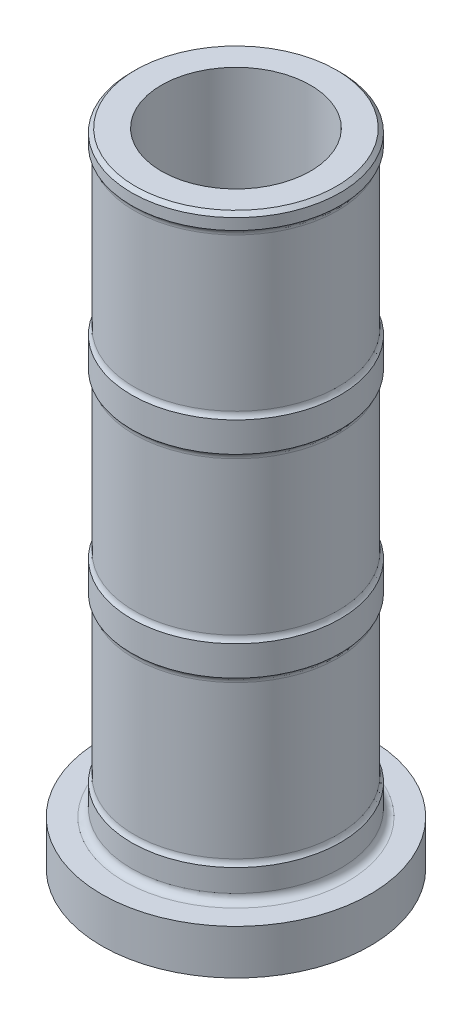
from build123d import *

# Parameters (mm, degrees)
SKETCH1_R           = 9
BOSS_EXTRUDE1_DEPTH = 3
SKETCH2_R           = 7
BOSS_EXTRUDE2_DEPTH = 2
SKETCH3_R           = 6.825
BOSS_EXTRUDE3_DEPTH = 11
SKETCH4_R           = 7
BOSS_EXTRUDE4_DEPTH = 2
SKETCH5_R           = 6.825
BOSS_EXTRUDE5_DEPTH = 11
SKETCH6_R           = 7
BOSS_EXTRUDE6_DEPTH = 2
SKETCH7_R           = 6.825
BOSS_EXTRUDE7_DEPTH = 11
SKETCH8_R           = 7
BOSS_EXTRUDE8_DEPTH = 1
FILLET3_R           = 0.5
CHAMFER2_SIZE       = 0.25
SKETCH13_R          = 5
CUT_EXTRUDE1_DEPTH  = 15
SKETCH14_R          = 4
CUT_EXTRUDE2_DEPTH  = 28
FILLET4_R           = 1


# Some blends are built 0.0001 mm under size
with BuildPart() as part:
    # Sketch1 → Boss-Extrude1 (new body)
    with BuildSketch(Plane(origin=(0, 0, 0), x_dir=(1, 0, 0), z_dir=(0, 1, 0))):
        with Locations(Location((0, 0, 0), (0, 0, 270))):
            Circle(SKETCH1_R)
    extrude(amount=BOSS_EXTRUDE1_DEPTH)

    # Sketch2 → Boss-Extrude2 (add)
    with BuildSketch(Plane(origin=(0, 3, 0), x_dir=(1, 0, 0), z_dir=(0, 1, 0))):
        with Locations(Location((0, 0, 0), (0, 0, 270))):
            Circle(SKETCH2_R)
    extrude(amount=BOSS_EXTRUDE2_DEPTH)

    # Sketch3 → Boss-Extrude3 (add)
    with BuildSketch(Plane(origin=(0, 5, 0), x_dir=(1, 0, 0), z_dir=(0, 1, 0))):
        with Locations(Location((0, 0, 0), (0, 0, 270))):
            Circle(SKETCH3_R)
    extrude(amount=BOSS_EXTRUDE3_DEPTH)

    # Sketch4 → Boss-Extrude4 (add)
    with BuildSketch(Plane(origin=(0, 16, 0), x_dir=(1, 0, 0), z_dir=(0, 1, 0))):
        with Locations(Location((0, 0, 0), (0, 0, 270))):
            Circle(SKETCH4_R)
    extrude(amount=BOSS_EXTRUDE4_DEPTH)

    # Sketch5 → Boss-Extrude5 (add)
    with BuildSketch(Plane(origin=(0, 18, 0), x_dir=(1, 0, 0), z_dir=(0, 1, 0))):
        with Locations(Location((0, 0, 0), (0, 0, 270))):
            Circle(SKETCH5_R)
    extrude(amount=BOSS_EXTRUDE5_DEPTH)

    # Sketch6 → Boss-Extrude6 (add)
    with BuildSketch(Plane(origin=(0, 29, 0), x_dir=(1, 0, 0), z_dir=(0, 1, 0))):
        with Locations(Location((0, 0, 0), (0, 0, 270))):
            Circle(SKETCH6_R)
    extrude(amount=BOSS_EXTRUDE6_DEPTH)

    # Sketch7 → Boss-Extrude7 (add)
    with BuildSketch(Plane(origin=(0, 31, 0), x_dir=(1, 0, 0), z_dir=(0, 1, 0))):
        with Locations(Location((0, 0, 0), (0, 0, 270))):
            Circle(SKETCH7_R)
    extrude(amount=BOSS_EXTRUDE7_DEPTH)

    # Sketch8 → Boss-Extrude8 (add)
    with BuildSketch(Plane(origin=(0, 42, 0), x_dir=(1, 0, 0), z_dir=(0, 1, 0))):
        with Locations(Location((0, 0, 0), (0, 0, 270))):
            Circle(SKETCH8_R)
    extrude(amount=BOSS_EXTRUDE8_DEPTH)

    # Fillet3
    # the kernel refuses this fillet: 0.5 mm, written as the material it adds along each edge
    with BuildSketch(Plane(origin=(0, 16, 0), x_dir=(0, 0, 1), z_dir=(-1, 0, 0))) as fillet3_piece_1:
        with BuildLine():
            CenterArc((7.325, -0.379967104), FILLET3_R, 130.541601874, 49.458398126)
            Line((6.825, -0.379967104), (6.815, -0.379967104))
            Line((6.815, -0.379967104), (6.815, 0))
            Line((6.815, 0), (6.825, 0.01))
            ThreePointArc((6.825, 0.01), (6.9125, 0.01), (6.9935, 0.007599342))
            Line((6.9935, 0.007599342), (7, 0))
        make_face()
    revolve(axis=Axis((0, 16, 0), (0, 1, 0)))
    with BuildSketch(Plane(origin=(0, 18, 0), x_dir=(0, 0, 1), z_dir=(-1, 0, 0))) as fillet3_piece_2:
        with BuildLine():
            CenterArc((7.325, 0.379967104), FILLET3_R, 180, 49.458398126)
            Line((7, 0), (6.9935, -0.007599342))
            ThreePointArc((6.9935, -0.007599342), (6.9125, -0.01), (6.825, -0.01))
            Line((6.825, -0.01), (6.815, 0))
            Line((6.815, 0), (6.815, 0.379967104))
            Line((6.815, 0.379967104), (6.825, 0.379967104))
        make_face()
    revolve(axis=Axis((0, 18, 0), (0, 1, 0)))
    with BuildSketch(Plane(origin=(0, 29, 0), x_dir=(0, 0, 1), z_dir=(-1, 0, 0))) as fillet3_piece_3:
        with BuildLine():
            CenterArc((7.325, -0.379967104), FILLET3_R, 130.541601874, 49.458398126)
            Line((6.825, -0.379967104), (6.815, -0.379967104))
            Line((6.815, -0.379967104), (6.815, 0))
            Line((6.815, 0), (6.825, 0.01))
            ThreePointArc((6.825, 0.01), (6.9125, 0.01), (6.9935, 0.007599342))
            Line((6.9935, 0.007599342), (7, 0))
        make_face()
    revolve(axis=Axis((0, 29, 0), (0, 1, 0)))
    with BuildSketch(Plane(origin=(0, 31, 0), x_dir=(0, 0, 1), z_dir=(-1, 0, 0))) as fillet3_piece_4:
        with BuildLine():
            CenterArc((7.325, 0.379967104), FILLET3_R, 180, 49.458398126)
            Line((7, 0), (6.9935, -0.007599342))
            ThreePointArc((6.9935, -0.007599342), (6.9125, -0.01), (6.825, -0.01))
            Line((6.825, -0.01), (6.815, 0))
            Line((6.815, 0), (6.815, 0.379967104))
            Line((6.815, 0.379967104), (6.825, 0.379967104))
        make_face()
    revolve(axis=Axis((0, 31, 0), (0, 1, 0)))
    with BuildSketch(Plane(origin=(0, 42, 0), x_dir=(0, 0, 1), z_dir=(-1, 0, 0))) as fillet3_piece_5:
        with BuildLine():
            CenterArc((7.325, -0.379967104), FILLET3_R, 130.541601874, 49.458398126)
            Line((6.825, -0.379967104), (6.815, -0.379967104))
            Line((6.815, -0.379967104), (6.815, 0))
            Line((6.815, 0), (6.825, 0.01))
            ThreePointArc((6.825, 0.01), (6.9125, 0.01), (6.9935, 0.007599342))
            Line((6.9935, 0.007599342), (7, 0))
        make_face()
    revolve(axis=Axis((0, 42, 0), (0, 1, 0)))
    with BuildSketch(Plane(origin=(0, 3, 0), x_dir=(0, 0, 1), z_dir=(-1, 0, 0))) as fillet3_piece_6:
        with BuildLine():
            CenterArc((7 + FILLET3_R, FILLET3_R), FILLET3_R, 180, 90)
            Line((7 + FILLET3_R, 0), (7 + FILLET3_R, -FILLET3_R * 0.02))
            Line((7 + FILLET3_R, -FILLET3_R * 0.02), (7 - FILLET3_R * 0.02, -FILLET3_R * 0.02))
            Line((7 - FILLET3_R * 0.02, -FILLET3_R * 0.02), (7 - FILLET3_R * 0.02, FILLET3_R))
            Line((7 - FILLET3_R * 0.02, FILLET3_R), (7, FILLET3_R))
        make_face()
    revolve(axis=Axis((0, 3, 0), (0, 1, 0)))
    with BuildSketch(Plane(origin=(0, 5, 0), x_dir=(0, 0, 1), z_dir=(-1, 0, 0))) as fillet3_piece_7:
        with BuildLine():
            CenterArc((7.325, 0.379967104), FILLET3_R, 180, 49.458398126)
            Line((7, 0), (6.9935, -0.007599342))
            ThreePointArc((6.9935, -0.007599342), (6.9125, -0.01), (6.825, -0.01))
            Line((6.825, -0.01), (6.815, 0))
            Line((6.815, 0), (6.815, 0.379967104))
            Line((6.815, 0.379967104), (6.825, 0.379967104))
        make_face()
    revolve(axis=Axis((0, 5, 0), (0, 1, 0)))

    # Chamfer2
    chamfer2_edges = [part.edges().sort_by_distance(p)[0] for p in [
        (0, 43, -7),
    ]]
    chamfer(chamfer2_edges, length=CHAMFER2_SIZE)

    # Sketch13 → Cut-Extrude1 (cut)
    with BuildSketch(Plane(origin=(0, 43, 0), x_dir=(1, 0, 0), z_dir=(0, 1, 0))):
        with Locations(Location((0, 0, 0), (0, 0, 270))):
            Circle(SKETCH13_R)
    extrude(amount=-CUT_EXTRUDE1_DEPTH, mode=Mode.SUBTRACT)

    # Sketch14 → Cut-Extrude2 (cut)
    with BuildSketch(Plane(origin=(0, 28, 0), x_dir=(1, 0, 0), z_dir=(0, 1, 0))):
        with Locations(Location((0, 0, 0), (0, 0, 270))):
            Circle(SKETCH14_R)
    extrude(amount=-CUT_EXTRUDE2_DEPTH, mode=Mode.SUBTRACT)

    # Fillet4
    fillet4_edges = [part.edges().sort_by_distance(p)[0] for p in [
        (0, 28, -5),
    ]]
    fillet(fillet4_edges, radius=FILLET4_R - 0.0001)  # a hair under: the kernel refuses the full size


solid = part.part
